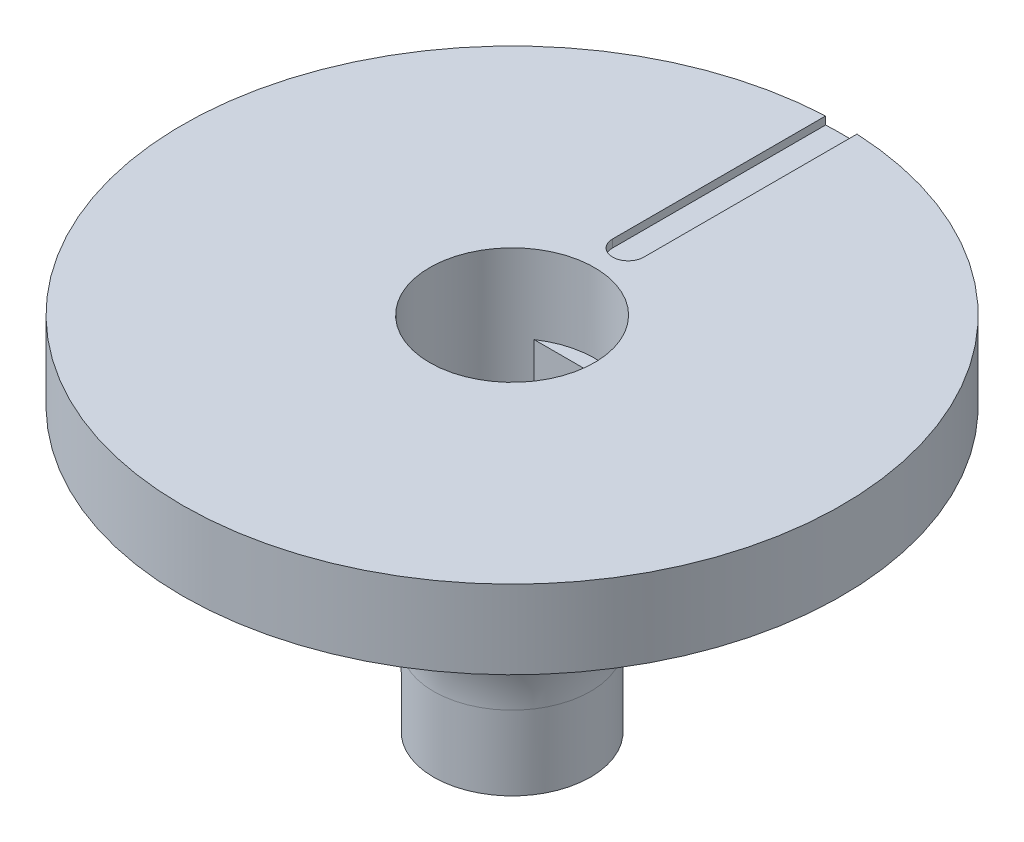
from build123d import *
from build123d.topology import SkipClean

# Parameters (mm, degrees)
SKETCH1_R           = 10.5
SKETCH1_R_2         = 8.6
BOSS_EXTRUDE1_DEPTH = 2
SKETCH2_W           = 0.8
SKETCH2_H           = 1.25
BOSS_EXTRUDE2_DEPTH = 1.25
BOSS_EXTRUDE3_START = 17.2
SKETCH2_2_W         = 0.8
SKETCH2_2_H         = 1.25
BOSS_EXTRUDE3_DEPTH = 1.25
BOSS_EXTRUDE4_START = 0.5
SKETCH3_R           = 10.5
BOSS_EXTRUDE4_DEPTH = 0.5
SKETCH5_R           = 3.25
BOSS_EXTRUDE5_DEPTH = 6
FILLET2_R           = 0.75
CUT_EXTRUDE1_DEPTH  = 5.5
FILLET1_R           = 0.25
SKETCH7_R           = 2.625
CUT_EXTRUDE2_DEPTH  = 2.5
CUT_EXTRUDE3_DEPTH  = 0.25
SKETCH11_R          = 2.5
BOSS_EXTRUDE6_DEPTH = 5
CUT_EXTRUDE4_START  = 5
CUT_EXTRUDE4_DEPTH  = 4.5
CHAMFER2_SIZE       = 0.25
FILLET3_R           = 5


with BuildPart() as part:
    # Sketch1 → Boss-Extrude1 (new body)
    with BuildSketch(Plane(origin=(0, 0, 0), x_dir=(1, 0, 0), z_dir=(0, 1, 0))):
        with Locations(Location((0, 0, 0), (0, 0, 270))):
            Circle(SKETCH1_R)
        with Locations(Location((0, 0, 0), (0, 0, 270))):
            Circle(SKETCH1_R_2, mode=Mode.SUBTRACT)
    extrude(amount=-BOSS_EXTRUDE1_DEPTH)

    # Sketch2 → Boss-Extrude2 (add)
    with BuildSketch(Plane(origin=(0, 0, 8.6), x_dir=(-1, 0, 0), z_dir=(0, 0, -1))):
        with Locations((0, -0.625)):
            Rectangle(SKETCH2_W, SKETCH2_H)
    extrude(amount=BOSS_EXTRUDE2_DEPTH)

    # Sketch2<2> → Boss-Extrude3 (add)
    with BuildSketch(Plane(origin=(0, 0, 8.6), x_dir=(-1, 0, 0), z_dir=(0, 0, -1)).offset(BOSS_EXTRUDE3_START)):
        with Locations((0, -0.625)):
            Rectangle(SKETCH2_2_W, SKETCH2_2_H)
    extrude(amount=-BOSS_EXTRUDE3_DEPTH)

    # Sketch3 → Boss-Extrude4 (add)
    with BuildSketch(Plane(origin=(0, 0, 0), x_dir=(1, 0, 0), z_dir=(0, 1, 0)).offset(BOSS_EXTRUDE4_START)):
        with Locations(Location((0, 0, 0), (0, 0, 270))):
            Circle(SKETCH3_R)
    extrude(amount=-BOSS_EXTRUDE4_DEPTH)

    # Sketch5 → Boss-Extrude5 (add)
    with BuildSketch(Plane.XZ):
        with Locations(Location((0, 0, 0), (0, 0, 90))):
            Circle(SKETCH5_R)
    extrude(amount=BOSS_EXTRUDE5_DEPTH)

    # Fillet2
    fillet2_edges = [part.edges().sort_by_distance(p)[0] for p in [
        (0, 0, -3.25),
    ]]
    fillet(fillet2_edges, radius=FILLET2_R)

    # Sketch4 → Cut-Extrude1 (cut)
    with BuildSketch(Plane(origin=(0, 0.5, 0), x_dir=(1, 0, 0), z_dir=(0, 1, 0))):
        with BuildLine():
            Line((-1.469693846, 2.175), (1.469693846, 2.175))
            ThreePointArc((1.469693846, 2.175), (0, -2.625), (-1.469693846, 2.175))
        make_face()
    extrude(amount=-CUT_EXTRUDE1_DEPTH, mode=Mode.SUBTRACT)

    # Fillet1
    fillet1_edges = [part.edges().sort_by_distance(p)[0] for p in [
        (-0.4, -1.25, 7.970346319),
        (0.4, -1.25, 7.970346319),
        (-0.4, -1.25, -7.970346319),
        (0.4, -1.25, -7.970346319),
    ]]
    fillet(fillet1_edges, radius=FILLET1_R)

    # Sketch7 → Cut-Extrude2 (cut)
    with SkipClean():  # the faces are left unmerged after this step: merging them gives an invalid solid
        with BuildSketch(Plane(origin=(0, 0.5, 0), x_dir=(1, 0, 0), z_dir=(0, 1, 0))):
            with Locations(Location((0, 0, 0), (0, 0, 270))):
                Circle(SKETCH7_R)
        extrude(amount=-CUT_EXTRUDE2_DEPTH, mode=Mode.SUBTRACT)

    # Sketch9 → Cut-Extrude3 (cut)
    with SkipClean():  # the faces are left unmerged after this step: merging them gives an invalid solid
        with BuildSketch(Plane(origin=(0, 0.5, 0), x_dir=(1, 0, 0), z_dir=(0, 1, 0))):
            with BuildLine():
                Line((-0.5, 3.7), (-0.5, 13.7))
                ThreePointArc((-0.5, 13.7), (0, 14.2), (0.5, 13.7))
                Line((0.5, 13.7), (0.5, 3.7))
                ThreePointArc((0.5, 3.7), (0, 3.2), (-0.5, 3.7))
            make_face()
        extrude(amount=-CUT_EXTRUDE3_DEPTH, mode=Mode.SUBTRACT)

    # Sketch11 → Boss-Extrude6 (add)
    with SkipClean():  # the faces are left unmerged after this step: merging them gives an invalid solid
        with BuildSketch(Plane.XZ.offset(6)):
            with Locations(Location((0, 0, 0), (0, 0, 270))):
                Circle(SKETCH11_R)
        extrude(amount=BOSS_EXTRUDE6_DEPTH)

    # Sketch10 → Cut-Extrude4 (cut)
    with SkipClean():  # the faces are left unmerged after this step: merging them gives an invalid solid
        with BuildSketch(Plane.XZ.offset(6).offset(CUT_EXTRUDE4_START)):
            Polygon((1.804219591, 0), (0.902109796, 1.5625), (-0.902109796, 1.5625), (-1.804219591, 0), (-0.902109796, -1.5625), (0.902109796, -1.5625), align=None)
        extrude(amount=-CUT_EXTRUDE4_DEPTH, mode=Mode.SUBTRACT)

    # Chamfer2
    chamfer2_edges = [part.edges().sort_by_distance(p)[0] for p in [
        (-1.353164693, -11, -0.78125),
        (-1.353164693, -11, 0.78125),
        (0, -11, 1.5625),
        (1.353164693, -11, 0.78125),
        (1.353164693, -11, -0.78125),
        (0, -11, -1.5625),
    ]]
    chamfer(chamfer2_edges, length=CHAMFER2_SIZE)

    # Fillet3
    # the kernel refuses this fillet: 5 mm, written as the material it adds along each edge
    with BuildSketch(Plane(origin=(0, -6, 0), x_dir=(0, 0, -1), z_dir=(-1, 0, 0))) as fillet3_piece_1:
        with BuildLine():
            CenterArc((7.5, 2.633913438), FILLET3_R, 180, 31.788330617)
            Line((3.25, 0), (3.165, -0.052678269))
            ThreePointArc((3.165, -0.052678269), (2.875, -0.1), (2.5, -0.1))
            Line((2.5, -0.1), (2.4, 0))
            Line((2.4, 0), (2.4, 2.633913438))
            Line((2.4, 2.633913438), (2.5, 2.633913438))
        make_face()
    revolve(axis=Axis((0, -6, 0), (0, -1, 0)))


solid = part.part
